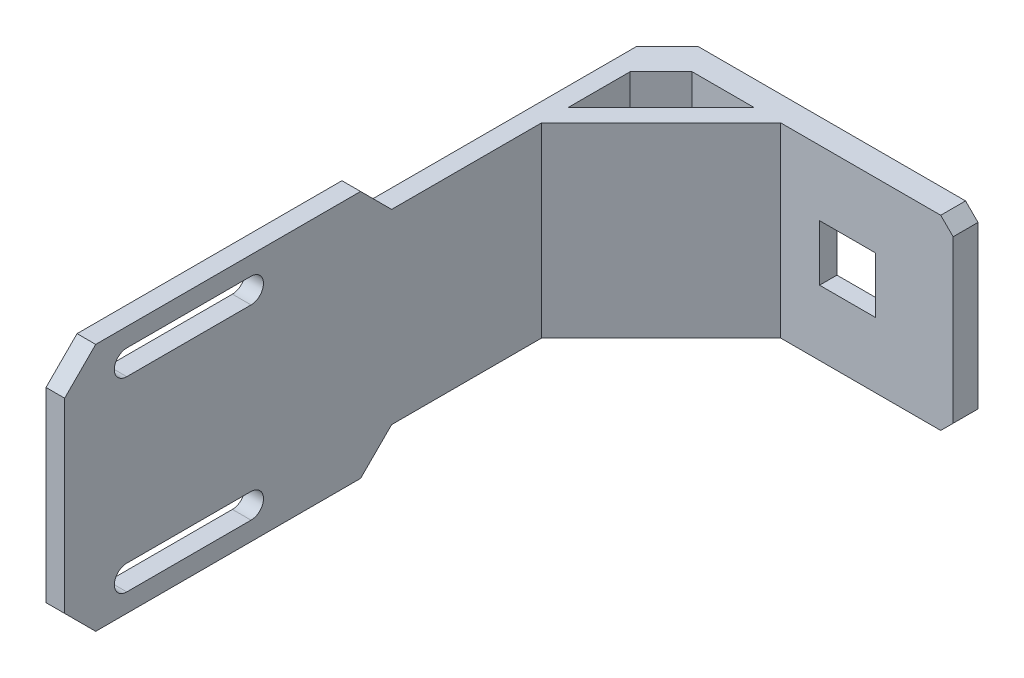
from build123d import *

# Parameters (mm, degrees)
SALIENTE_EXTRUIR1_DEPTH = 40
CORTAR_EXTRUIR1_DEPTH   = 110.100828683
CHAFL_N1_SIZE           = 5
CROQUIS3_W              = 52.370156311
CROQUIS3_H              = 5
CORTAR_EXTRUIR2_DEPTH   = 110.100828683
CHAFL_N2_SIZE           = 5
CROQUIS4_W              = 25
CROQUIS4_H              = 25
CORTAR_EXTRUIR3_DEPTH   = 1.2
CROQUIS5_W              = 9
CROQUIS5_H              = 9
CORTAR_EXTRUIR4_DEPTH   = 118.586419677
CROQUIS6_W              = 10
CROQUIS6_H              = 9
CORTAR_EXTRUIR5_DEPTH   = 2
CHAFL_N5_SIZE           = 2
CHAFL_N6_SIZE           = 5


with BuildPart() as part:
    # Croquis1 → Saliente-Extruir1 (new body)
    with BuildSketch(Plane(origin=(0, 0, 0), x_dir=(1, 0, 0), z_dir=(0, 1, 0))):
        Polygon((-0.349963823, 11.66546078), (49.650036177, 11.66546078), (49.650036177, 7.66546078), (21.892676864, 7.66546078), (2.650036177, -11.577179907), (2.650036177, -88.33453922), (-0.349963823, -88.33453922), align=None)
        Polygon((17.650036177, 7.66546078), (2.650036177, -7.33453922), (2.650036177, 7.66546078), align=None, mode=Mode.SUBTRACT)
    extrude(amount=SALIENTE_EXTRUIR1_DEPTH)

    # Croquis2 → Cortar-Extruir1 (cut, through all)
    with BuildSketch(Plane.ZY.offset(0.349963823)):
        with BuildLine():
            Line((58.33453922, 37), (78.33453922, 37))
            ThreePointArc((78.33453922, 37), (80.33453922, 35), (78.33453922, 33))
            Line((78.33453922, 33), (58.33453922, 33))
            ThreePointArc((58.33453922, 33), (56.33453922, 35), (58.33453922, 37))
        make_face()
        with BuildLine():
            Line((58.33453922, 7), (78.33453922, 7))
            ThreePointArc((78.33453922, 7), (80.33453922, 5), (78.33453922, 3))
            Line((78.33453922, 3), (58.33453922, 3))
            ThreePointArc((58.33453922, 3), (56.33453922, 5), (58.33453922, 7))
        make_face()
    extrude(amount=-CORTAR_EXTRUIR1_DEPTH, mode=Mode.SUBTRACT)

    # Chaflán1
    chafl_n1_edges = [part.edges().sort_by_distance(p)[0] for p in [
        (-0.349963823, 20, -11.66546078),
        (2.650036177, 20, -7.66546078),
    ]]
    chamfer(chafl_n1_edges, length=CHAFL_N1_SIZE)

    # Croquis3 → Cortar-Extruir2 (cut, through all)
    with BuildSketch(Plane.ZY.offset(0.349963823)):
        with Locations((14.519617376, 2.5)):
            Rectangle(CROQUIS3_W, CROQUIS3_H)
        with Locations((14.519617376, 37.5)):
            Rectangle(CROQUIS3_W, CROQUIS3_H)
    extrude(amount=-CORTAR_EXTRUIR2_DEPTH, mode=Mode.SUBTRACT)

    # Chaflán2
    chafl_n2_edges = [part.edges().sort_by_distance(p)[0] for p in [
        (1.150036177, 35, 40.704695531),
        (1.150036177, 5, 40.704695531),
    ]]
    chamfer(chafl_n2_edges, length=CHAFL_N2_SIZE - 0.0001)  # a hair under: the kernel refuses the full size

    # Croquis4 → Cortar-Extruir3 (cut)
    with BuildSketch(Plane(origin=(0, 0, -11.66546078), x_dir=(-1, 0, 0), z_dir=(0, 0, -1))):
        with Locations((-34.650036177, 20)):
            Rectangle(CROQUIS4_W, CROQUIS4_H)
    extrude(amount=-CORTAR_EXTRUIR3_DEPTH, mode=Mode.SUBTRACT)

    # Croquis5 → Cortar-Extruir4 (cut, through all)
    with BuildSketch(Plane(origin=(0, 0, -10.46546078), x_dir=(-1, 0, 0), z_dir=(0, 0, -1))):
        with Locations((-32.650036177, 20)):
            Rectangle(CROQUIS5_W, CROQUIS5_H)
    extrude(amount=-CORTAR_EXTRUIR4_DEPTH, mode=Mode.SUBTRACT)

    # Croquis6 → Cortar-Extruir5 (cut)
    with BuildSketch(Plane(origin=(0, 0, -10.46546078), x_dir=(-1, 0, 0), z_dir=(0, 0, -1))):
        with Locations((-42.150036177, 20)):
            Rectangle(CROQUIS6_W, CROQUIS6_H)
    extrude(amount=-CORTAR_EXTRUIR5_DEPTH, mode=Mode.SUBTRACT)

    # Chaflán5
    chafl_n5_edges = [part.edges().sort_by_distance(p)[0] for p in [
        (49.650036177, 5, -9.66546078),
        (49.650036177, 35, -9.66546078),
    ]]
    chamfer(chafl_n5_edges, length=CHAFL_N5_SIZE)

    # Chaflán6
    chafl_n6_edges = [part.edges().sort_by_distance(p)[0] for p in [
        (1.150036177, 40, 88.33453922),
        (1.150036177, 0, 88.33453922),
    ]]
    chamfer(chafl_n6_edges, length=CHAFL_N6_SIZE)


solid = part.part
